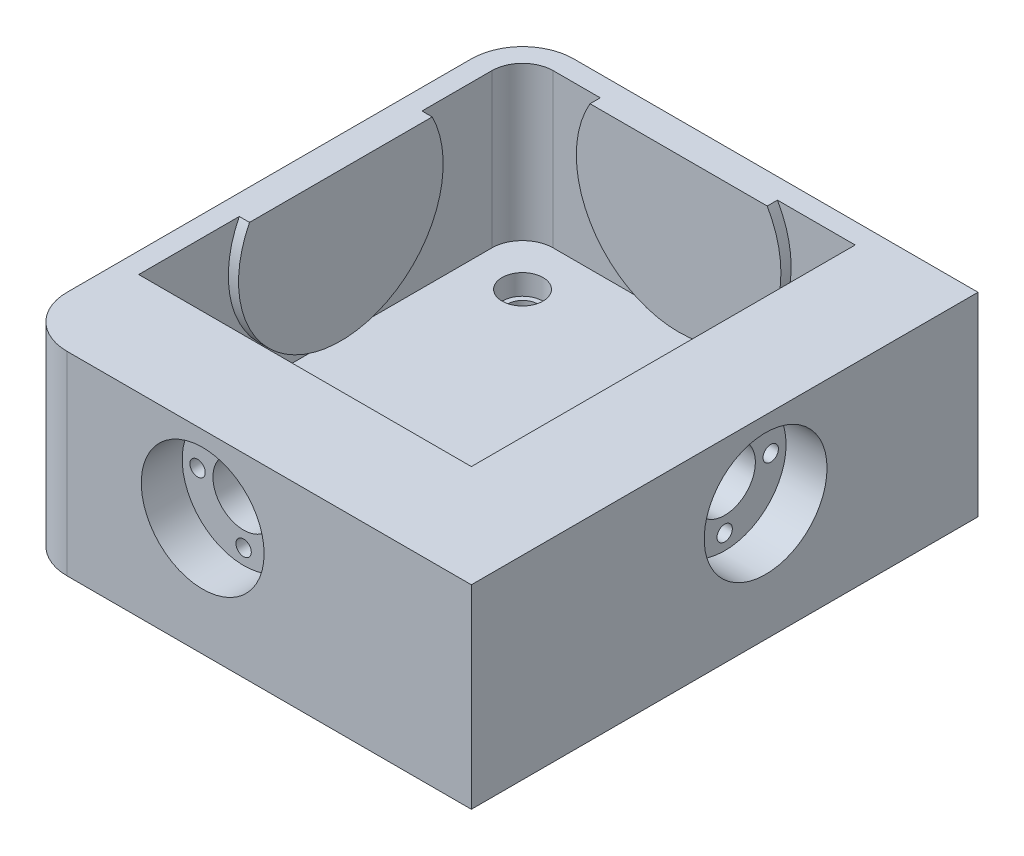
from build123d import *

# Parameters (mm, degrees)
EXTRUDE_1_DEPTH     = 19
SHELL_START         = 4
SHELL_2_DEPTH       = 15
SKETCH_2_R          = 3
CUT_EXTRUDE_1_DEPTH = 15
SKETCH_3_R          = 6
CUT_EXTRUDE_2_DEPTH = 4
SKETCH_4_R          = 3
CUT_EXTRUDE_3_DEPTH = 18
SKETCH_5_R          = 6
CUT_EXTRUDE_4_DEPTH = 4
SKETCH_8_R          = 0.75
CUT_EXTRUDE_5_DEPTH = 4
SKETCH_9_R          = 0.75
CUT_EXTRUDE_6_DEPTH = 4
EXTRUDE_4_DEPTH     = 1
EXTRUDE_5_DEPTH     = 1
SKETCH_13_R         = 2
CUT_EXTRUDE_7_DEPTH = 2
SKETCH_14_R         = 1.5
CUT_EXTRUDE_8_DEPTH = 9


# Read off the part's stored shape, not the designer's step: 抽壳2
with BuildPart() as part:
    # 草图1 → 凸台-拉伸1 (new body)
    with BuildSketch(Plane(origin=(0, 0, 0), x_dir=(1, 0, 0), z_dir=(0, 1, 0))):
        with BuildLine():
            Line((5, 0), (44.5, 0))
            Line((44.5, 0), (44.5, 49.5))
            Line((44.5, 49.5), (5, 49.5))
            ThreePointArc((5, 49.5), (1.464466094, 48.035533906), (0, 44.5))
            Line((0, 44.5), (0, 5))
            ThreePointArc((0, 5), (1.464466094, 1.464466094), (5, 0))
        make_face()
    extrude(amount=EXTRUDE_1_DEPTH)

    # 抽壳2 outline → 抽壳2 (cut)
    with BuildSketch(Plane(origin=(0, 0, 0), x_dir=(1, 0, 0), z_dir=(0, 1, 0)).offset(SHELL_START)):
        with BuildLine():
            ThreePointArc((5, 47.5), (2.878679656, 46.621320344), (2, 44.5))
            Line((2, 44.5), (2, 10))
            Line((2, 10), (34.5, 10))
            Line((34.5, 10), (34.5, 47.5))
            Line((34.5, 47.5), (5, 47.5))
        make_face()
    extrude(amount=SHELL_2_DEPTH, mode=Mode.SUBTRACT)

    # 草图2 → 切除-拉伸1 (cut)
    with BuildSketch(Plane.XY):
        with Locations((18.25, 11.5)):
            Circle(SKETCH_2_R)
    extrude(amount=-CUT_EXTRUDE_1_DEPTH, mode=Mode.SUBTRACT)

    # 草图3 → 切除-拉伸2 (cut)
    with BuildSketch(Plane.XY):
        with Locations((18.25, 11.5)):
            Circle(SKETCH_3_R)
    extrude(amount=-CUT_EXTRUDE_2_DEPTH, mode=Mode.SUBTRACT)

    # 草图4 → 切除-拉伸3 (cut)
    with BuildSketch(Plane(origin=(44.5, 0, 0), x_dir=(0, 0, -1), z_dir=(1, 0, 0))):
        with Locations((28.75, 11.5)):
            Circle(SKETCH_4_R)
    extrude(amount=-CUT_EXTRUDE_3_DEPTH, mode=Mode.SUBTRACT)

    # 草图5 → 切除-拉伸4 (cut)
    with BuildSketch(Plane(origin=(44.5, 0, 0), x_dir=(0, 0, -1), z_dir=(1, 0, 0))):
        with Locations((28.75, 11.5)):
            Circle(SKETCH_5_R)
    extrude(amount=-CUT_EXTRUDE_4_DEPTH, mode=Mode.SUBTRACT)

    # 草图8 → 切除-拉伸5 (cut)
    with BuildSketch(Plane(origin=(40.5, 0, 0), x_dir=(0, 0, -1), z_dir=(1, 0, 0))):
        with Locations((28.75, 16)):
            Circle(SKETCH_8_R)
        with Locations((33.25, 11.5)):
            Circle(SKETCH_8_R)
        with Locations((24.25, 11.5)):
            Circle(SKETCH_8_R)
        with Locations((28.75, 7)):
            Circle(SKETCH_8_R)
    extrude(amount=-CUT_EXTRUDE_5_DEPTH, mode=Mode.SUBTRACT)

    # 草图9 → 切除-拉伸6 (cut)
    with BuildSketch(Plane.XY.offset(-4)):
        with Locations((18.25, 16)):
            Circle(SKETCH_9_R)
        with Locations((22.75, 11.5)):
            Circle(SKETCH_9_R)
        with Locations((18.25, 7)):
            Circle(SKETCH_9_R)
        with Locations((13.75, 11.5)):
            Circle(SKETCH_9_R)
    extrude(amount=-CUT_EXTRUDE_6_DEPTH, mode=Mode.SUBTRACT)

    # 草图10 → 凸台-拉伸4 (add)
    with BuildSketch(Plane.XY.offset(-47.5)):
        with BuildLine():
            Line((9.594076089, 19), (26.905923911, 19))
            ThreePointArc((26.905923911, 19), (18.25, 4.0075), (9.594076089, 19))
        make_face()
    extrude(amount=EXTRUDE_4_DEPTH)

    # 草图11 → 凸台-拉伸5 (add)
    with BuildSketch(Plane(origin=(2, 0, 0), x_dir=(0, 0, -1), z_dir=(1, 0, 0))):
        with BuildLine():
            Line((19.825313731, 19), (37.674686269, 19))
            ThreePointArc((37.674686269, 19), (28.75, 4.505), (19.825313731, 19))
        make_face()
    extrude(amount=EXTRUDE_5_DEPTH)

    # 草图13 → 切除-拉伸7 (cut)
    with BuildSketch(Plane(origin=(0, 4, 0), x_dir=(1, 0, 0), z_dir=(0, 1, 0))):
        with Locations(Location((7, 15, 0), (0, 0, 270))):
            Circle(SKETCH_13_R)
        with Locations(Location((7, 42.5, 0), (0, 0, 270))):
            Circle(SKETCH_13_R)
        with Locations(Location((29.5, 15, 0), (0, 0, 270))):
            Circle(SKETCH_13_R)
        with Locations(Location((29.5, 42.5, 0), (0, 0, 270))):
            Circle(SKETCH_13_R)
    extrude(amount=-CUT_EXTRUDE_7_DEPTH, mode=Mode.SUBTRACT)

    # 草图14 → 切除-拉伸8 (cut)
    with BuildSketch(Plane(origin=(0, 4, 0), x_dir=(1, 0, 0), z_dir=(0, 1, 0))):
        with Locations(Location((7, 15, 0), (0, 0, 270))):
            Circle(SKETCH_14_R)
        with Locations(Location((7, 42.5, 0), (0, 0, 270))):
            Circle(SKETCH_14_R)
        with Locations(Location((29.5, 15, 0), (0, 0, 270))):
            Circle(SKETCH_14_R)
        with Locations(Location((29.5, 42.5, 0), (0, 0, 270))):
            Circle(SKETCH_14_R)
    extrude(amount=-CUT_EXTRUDE_8_DEPTH, mode=Mode.SUBTRACT)


solid = part.part
